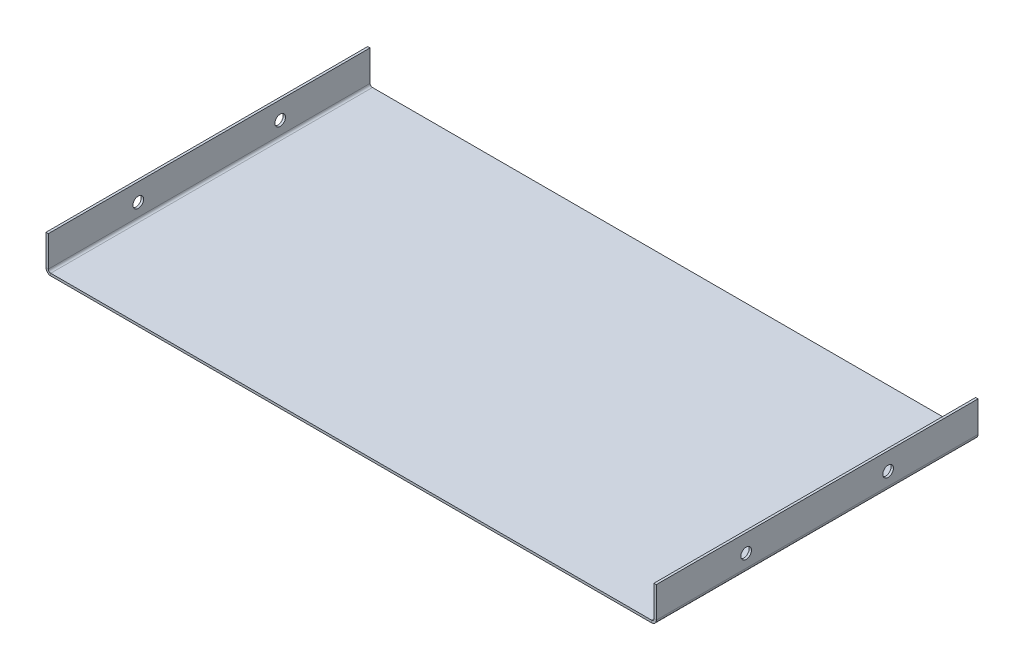
from build123d import *

# Parameters (mm, degrees)
SKETCH1_W                    = 256
SKETCH1_H                    = 136
BASE_FLANGE1_DEPTH           = 1
EDGE_FLANGE1_STRIP_W         = 6
EDGE_FLANGE1_STRIP_H         = 1
EDGE_FLANGE1_STRIP_CUT_DEPTH = 136
EDGE_FLANGE1_DEPTH           = 136
EDGE_FLANGE2_STRIP_W         = 6
EDGE_FLANGE2_STRIP_H         = 1
EDGE_FLANGE2_STRIP_CUT_DEPTH = 136
EDGE_FLANGE2_DEPTH           = 136
SKETCH12_R                   = 2.25
CUT_EXTRUDE1_DEPTH           = 278


# Sheet-metal steps are written as plain solids
with BuildPart() as part:
    # Sketch1 → Base-Flange1 (new body)
    with BuildSketch(Plane(origin=(0, 0, 0), x_dir=(1, 0, 0), z_dir=(0, 1, 0))):
        with Locations((128, 68)):
            Rectangle(SKETCH1_W, SKETCH1_H)
    extrude(amount=-BASE_FLANGE1_DEPTH)

    # Edge-Flange1 strip (across the edge) → Edge-Flange1 strip cut (cut)
    with BuildSketch(Plane.XY.offset(-136)):
        with Locations((-2, -0.5)):
            Rectangle(EDGE_FLANGE1_STRIP_W, EDGE_FLANGE1_STRIP_H)
    extrude(amount=EDGE_FLANGE1_STRIP_CUT_DEPTH, mode=Mode.SUBTRACT)

    # Edge-Flange1 section (across the edge) → Edge-Flange1 (add)
    with BuildSketch(Plane.XY.offset(-136)):
        with BuildLine():
            Line((-1, 1), (-1, 14))
            Line((-1, 14), (0, 14))
            Line((0, 14), (0, 1))
            ThreePointArc((0, 1), (0.292893219, 0.292893219), (1, 0))
            Line((1, 0), (1, -1))
            ThreePointArc((1, -1), (-0.414213562, -0.414213562), (-1, 1))
        make_face()
    extrude(amount=EDGE_FLANGE1_DEPTH)

    # Edge-Flange2 strip (across the edge) → Edge-Flange2 strip cut (cut)
    with BuildSketch(Plane(origin=(256, 0, 0), x_dir=(-1, 0, 0), z_dir=(0, 0, -1))):
        with Locations((-2, -0.5)):
            Rectangle(EDGE_FLANGE2_STRIP_W, EDGE_FLANGE2_STRIP_H)
    extrude(amount=EDGE_FLANGE2_STRIP_CUT_DEPTH, mode=Mode.SUBTRACT)

    # Edge-Flange2 section (across the edge) → Edge-Flange2 (add)
    with BuildSketch(Plane(origin=(256, 0, 0), x_dir=(-1, 0, 0), z_dir=(0, 0, -1))):
        with BuildLine():
            Line((-1, 1), (-1, 14))
            Line((-1, 14), (0, 14))
            Line((0, 14), (0, 1))
            ThreePointArc((0, 1), (0.292893219, 0.292893219), (1, 0))
            Line((1, 0), (1, -1))
            ThreePointArc((1, -1), (-0.414213562, -0.414213562), (-1, 1))
        make_face()
    extrude(amount=EDGE_FLANGE2_DEPTH)

    # Sketch12 → Cut-Extrude1 (cut)
    with BuildSketch(Plane(origin=(-2, -333.400026456, -193.062536038), x_dir=(0, 1, 0), z_dir=(-1, 0, 0))):
        with Locations(Location((339.900026456, -95.062536038, 0), (0, 0, 180))):
            Circle(SKETCH12_R)
        with Locations(Location((339.900026456, -155.062536038, 0), (0, 0, 180))):
            Circle(SKETCH12_R)
    extrude(amount=-CUT_EXTRUDE1_DEPTH, mode=Mode.SUBTRACT)


solid = part.part
